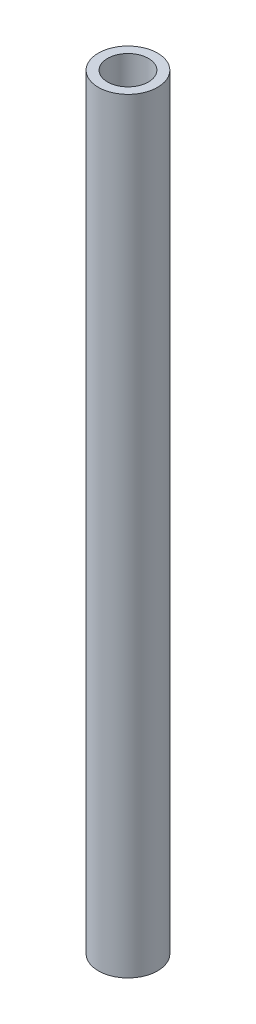
from build123d import *

# Parameters (mm, degrees)
SKETCH1_R           = 4.7625
SKETCH1_R_2         = 3.2893
BOSS_EXTRUDE1_DEPTH = 123


with BuildPart() as part:
    # Sketch1 → Boss-Extrude1 (new body)
    with BuildSketch(Plane(origin=(0, 0, 0), x_dir=(1, 0, 0), z_dir=(0, 1, 0))):
        Circle(SKETCH1_R)
        Circle(SKETCH1_R_2, mode=Mode.SUBTRACT)
    extrude(amount=BOSS_EXTRUDE1_DEPTH)


solid = part.part
